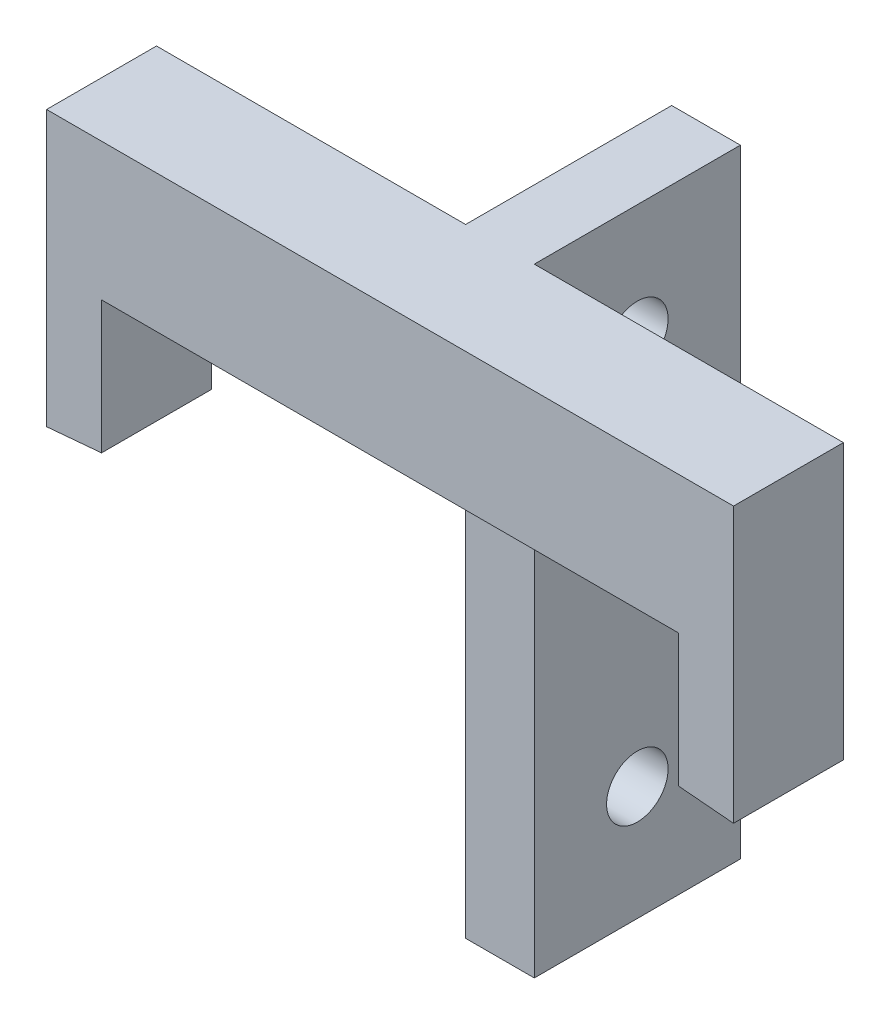
from build123d import *

# Parameters (mm, degrees)
SKETCH1_W           = 3.175
SKETCH1_H           = 28.575
BOSS_EXTRUDE1_DEPTH = 9.525
CUT_EXTRUDE1_REACH  = 19.462
SKETCH4_R           = 1.4224
BOSS_EXTRUDE3_DEPTH = 5.08


with BuildPart() as part:
    # Sketch1 → Boss-Extrude1 (new body)
    with BuildSketch(Plane.XY):
        Rectangle(SKETCH1_W, SKETCH1_H)
    extrude(amount=BOSS_EXTRUDE1_DEPTH)

    # Sketch4 → Cut-Extrude1 (cut, up to next)
    with BuildSketch(Plane(origin=(1.5875, 0, 0), x_dir=(0, 0, -1), z_dir=(1, 0, 0)), mode=Mode.PRIVATE) as cut_extrude1_sk1:
        with Locations((-4.7625, -9.0043)):
            Circle(SKETCH4_R)
    cut_extrude1_tool1 = extrude(cut_extrude1_sk1.sketch, amount=-CUT_EXTRUDE1_REACH, mode=Mode.PRIVATE) & part.part
    # Sketch4 → Cut-Extrude1 (cut, up to next)
    with BuildSketch(Plane(origin=(1.5875, 0, 0), x_dir=(0, 0, -1), z_dir=(1, 0, 0)), mode=Mode.PRIVATE) as cut_extrude1_sk2:
        with Locations((-4.7625, 9.0043)):
            Circle(SKETCH4_R)
    cut_extrude1_tool2 = extrude(cut_extrude1_sk2.sketch, amount=-CUT_EXTRUDE1_REACH, mode=Mode.PRIVATE) & part.part
    add(cut_extrude1_tool1.solids().sort_by_distance((1.5875, -9.0043, 4.7625))[0], mode=Mode.SUBTRACT)
    add(cut_extrude1_tool2.solids().sort_by_distance((1.5875, 9.0043, 4.7625))[0], mode=Mode.SUBTRACT)

    # Sketch5 → Boss-Extrude3 (add)
    with BuildSketch(Plane.XY.offset(9.525)):
        Polygon((15.875, 14.2875), (-15.875, 14.2875), (-15.875, 1.5875), (-13.335, 1.809721205), (-13.335, 7.9375), (13.335, 7.9375), (13.335, 1.809721205), (15.875, 1.5875), align=None)
    extrude(amount=BOSS_EXTRUDE3_DEPTH)


solid = part.part
